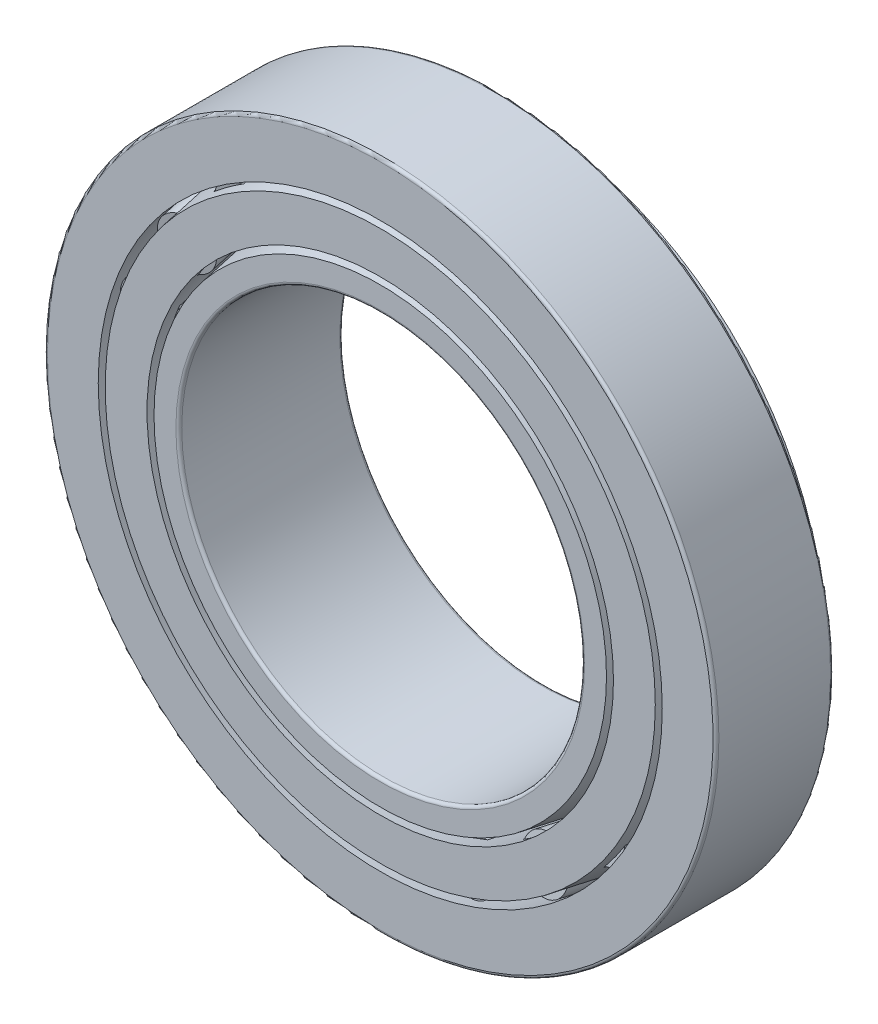
from build123d import *

# Parameters (mm, degrees)
CIRPATTERN1_COUNT = 20
CIRPATTERN2_COUNT = 20
FILLET1_R         = 0.555625
FILLET2_R         = 0.555625


with BuildPart() as part:
    # Sketch1 → Revolve1 (revolve)
    with BuildSketch(Plane(origin=(0, 0, 0), x_dir=(0, 0, -1), z_dir=(1, 0, 0))):
        Polygon((-15.50035, 63.5), (6.72465, 63.5), (6.72465, 57.258867146), (-15.50035, 53.34), align=None)
    revolve(axis=Axis((0, 0, 15.50035), (0, 0, -1)))

    # Fillet1
    fillet1_edges = [part.edges().sort_by_distance(p)[0] for p in [
        (0, -63.5, -6.72465),
        (0, -63.5, 15.50035),
    ]]
    fillet(fillet1_edges, radius=FILLET1_R)


with BuildPart() as body_2:
    # Sketch5 → Revolve4 (revolve)
    with BuildSketch(Plane(origin=(0, 0, 0), x_dir=(0, 0, -1), z_dir=(1, 0, 0))):
        Polygon((15.50035, 48.26), (-15.50035, 42.793740169), (-15.50035, 38.1), (15.50035, 38.1), align=None)
    revolve(axis=Axis((0, 0, 15.50035), (0, 0, -1)))

    # Fillet2
    fillet2_edges = [body_2.edges().sort_by_distance(p)[0] for p in [
        (0, -38.1, -15.50035),
        (0, -38.1, 15.50035),
    ]]
    fillet(fillet2_edges, radius=FILLET2_R)


with BuildPart() as body_3:
    # Sketch2 → Revolve2 (revolve)
    with BuildSketch(Plane(origin=(0, 0, 0), x_dir=(0, 0, -1), z_dir=(1, 0, 0))):
        Polygon((-15.50035, 52.021717521), (-15.50035, 44.112022648), (6.72465, 48.030889794), (12.988910419, 49.13544792), (11.636272932, 56.806636309), (6.72465, 55.940584667), align=None)
    revolve(axis=Axis((0, 0, 15.50035), (0, 0, -1)))

    # Sketch3 → Cut-Revolve1 (revolve, cut)
    with BuildSketch(Plane(origin=(0, 0, 0), x_dir=(0, 0, -1), z_dir=(1, 0, 0))):
        Polygon((-12.795075026, 48.543883053), (-13.696833351, 53.658008645), (5.822891675, 57.099862824), (6.72465, 51.985737231), align=None)
    cut_revolve1 = revolve(axis=Axis((0, 48.066870085, 15.50035), (0, 0.17364817766692758, -0.9848077530122086)), mode=Mode.SUBTRACT)

    # CirPattern1: Cut-Revolve1 ×20 about axis
    cirpattern1_axis = Axis((0, 0, -15.50035), (0, 0, 1))
    for i in range(1, CIRPATTERN1_COUNT):
        add(cut_revolve1.rotate(cirpattern1_axis, i * 360 / CIRPATTERN1_COUNT), mode=Mode.SUBTRACT)


with BuildPart() as body_4:
    # Sketch4 → Revolve3 (revolve)
    with BuildSketch(Plane(origin=(0, 0, 0), x_dir=(0, 0, -1), z_dir=(1, 0, 0))):
        Polygon((-13.652726713, 53.407867476), (5.866998312, 56.849721654), (6.72465, 51.985737231), (-12.795075026, 48.543883053), align=None)
    revolve(axis=Axis((0, 48.066870085, 15.50035), (0, 0.17364817766692758, -0.9848077530122086)))


with BuildPart() as cirpattern2_1:
    # CirPattern2: pattern copy
    add(body_4.part.rotate(Axis((0, 0, -15.50035), (0, 0, 1)), 1 * 360 / CIRPATTERN2_COUNT))


with BuildPart() as cirpattern2_2:
    # CirPattern2: pattern copy
    add(body_4.part.rotate(Axis((0, 0, -15.50035), (0, 0, 1)), 2 * 360 / CIRPATTERN2_COUNT))


with BuildPart() as cirpattern2_3:
    # CirPattern2: pattern copy
    add(body_4.part.rotate(Axis((0, 0, -15.50035), (0, 0, 1)), 3 * 360 / CIRPATTERN2_COUNT))


with BuildPart() as cirpattern2_4:
    # CirPattern2: pattern copy
    add(body_4.part.rotate(Axis((0, 0, -15.50035), (0, 0, 1)), 4 * 360 / CIRPATTERN2_COUNT))


with BuildPart() as cirpattern2_5:
    # CirPattern2: pattern copy
    add(body_4.part.rotate(Axis((0, 0, -15.50035), (0, 0, 1)), 5 * 360 / CIRPATTERN2_COUNT))


with BuildPart() as cirpattern2_6:
    # CirPattern2: pattern copy
    add(body_4.part.rotate(Axis((0, 0, -15.50035), (0, 0, 1)), 6 * 360 / CIRPATTERN2_COUNT))


with BuildPart() as cirpattern2_7:
    # CirPattern2: pattern copy
    add(body_4.part.rotate(Axis((0, 0, -15.50035), (0, 0, 1)), 7 * 360 / CIRPATTERN2_COUNT))


with BuildPart() as cirpattern2_8:
    # CirPattern2: pattern copy
    add(body_4.part.rotate(Axis((0, 0, -15.50035), (0, 0, 1)), 8 * 360 / CIRPATTERN2_COUNT))


with BuildPart() as cirpattern2_9:
    # CirPattern2: pattern copy
    add(body_4.part.rotate(Axis((0, 0, -15.50035), (0, 0, 1)), 9 * 360 / CIRPATTERN2_COUNT))


with BuildPart() as cirpattern2_10:
    # CirPattern2: pattern copy
    add(body_4.part.rotate(Axis((0, 0, -15.50035), (0, 0, 1)), 10 * 360 / CIRPATTERN2_COUNT))


with BuildPart() as cirpattern2_11:
    # CirPattern2: pattern copy
    add(body_4.part.rotate(Axis((0, 0, -15.50035), (0, 0, 1)), 11 * 360 / CIRPATTERN2_COUNT))


with BuildPart() as cirpattern2_12:
    # CirPattern2: pattern copy
    add(body_4.part.rotate(Axis((0, 0, -15.50035), (0, 0, 1)), 12 * 360 / CIRPATTERN2_COUNT))


with BuildPart() as cirpattern2_13:
    # CirPattern2: pattern copy
    add(body_4.part.rotate(Axis((0, 0, -15.50035), (0, 0, 1)), 13 * 360 / CIRPATTERN2_COUNT))


with BuildPart() as cirpattern2_14:
    # CirPattern2: pattern copy
    add(body_4.part.rotate(Axis((0, 0, -15.50035), (0, 0, 1)), 14 * 360 / CIRPATTERN2_COUNT))


with BuildPart() as cirpattern2_15:
    # CirPattern2: pattern copy
    add(body_4.part.rotate(Axis((0, 0, -15.50035), (0, 0, 1)), 15 * 360 / CIRPATTERN2_COUNT))


with BuildPart() as cirpattern2_16:
    # CirPattern2: pattern copy
    add(body_4.part.rotate(Axis((0, 0, -15.50035), (0, 0, 1)), 16 * 360 / CIRPATTERN2_COUNT))


with BuildPart() as cirpattern2_17:
    # CirPattern2: pattern copy
    add(body_4.part.rotate(Axis((0, 0, -15.50035), (0, 0, 1)), 17 * 360 / CIRPATTERN2_COUNT))


with BuildPart() as cirpattern2_18:
    # CirPattern2: pattern copy
    add(body_4.part.rotate(Axis((0, 0, -15.50035), (0, 0, 1)), 18 * 360 / CIRPATTERN2_COUNT))


with BuildPart() as cirpattern2_19:
    # CirPattern2: pattern copy
    add(body_4.part.rotate(Axis((0, 0, -15.50035), (0, 0, 1)), 19 * 360 / CIRPATTERN2_COUNT))


solid = Compound([part.part, body_2.part, body_3.part, body_4.part, cirpattern2_1.part, cirpattern2_2.part, cirpattern2_3.part, cirpattern2_4.part, cirpattern2_5.part, cirpattern2_6.part, cirpattern2_7.part, cirpattern2_8.part, cirpattern2_9.part, cirpattern2_10.part, cirpattern2_11.part, cirpattern2_12.part, cirpattern2_13.part, cirpattern2_14.part, cirpattern2_15.part, cirpattern2_16.part, cirpattern2_17.part, cirpattern2_18.part, cirpattern2_19.part])
